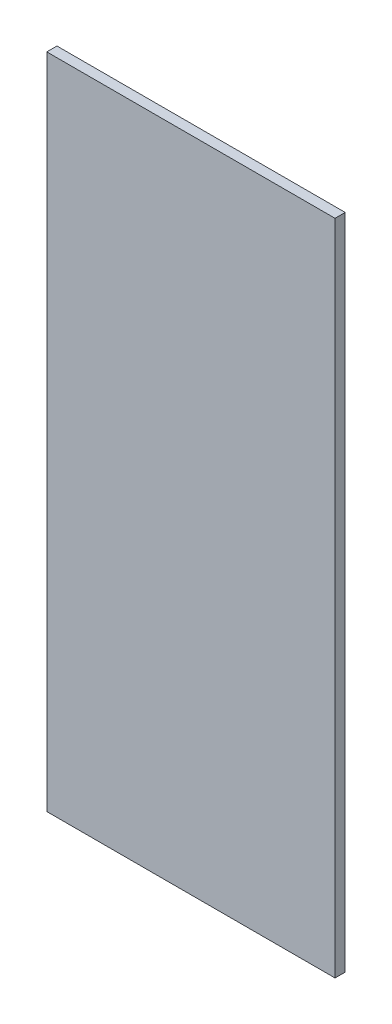
from build123d import *

# Parameters (mm, degrees)
SKETCH1_W           = 170
SKETCH1_H           = 388
BOSS_EXTRUDE1_DEPTH = 6


with BuildPart() as part:
    # Sketch1 → Boss-Extrude1 (new body)
    with BuildSketch(Plane.XY):
        with Locations((56.428571429, 171.104761905)):
            Rectangle(SKETCH1_W, SKETCH1_H)
    extrude(amount=BOSS_EXTRUDE1_DEPTH)


solid = part.part
